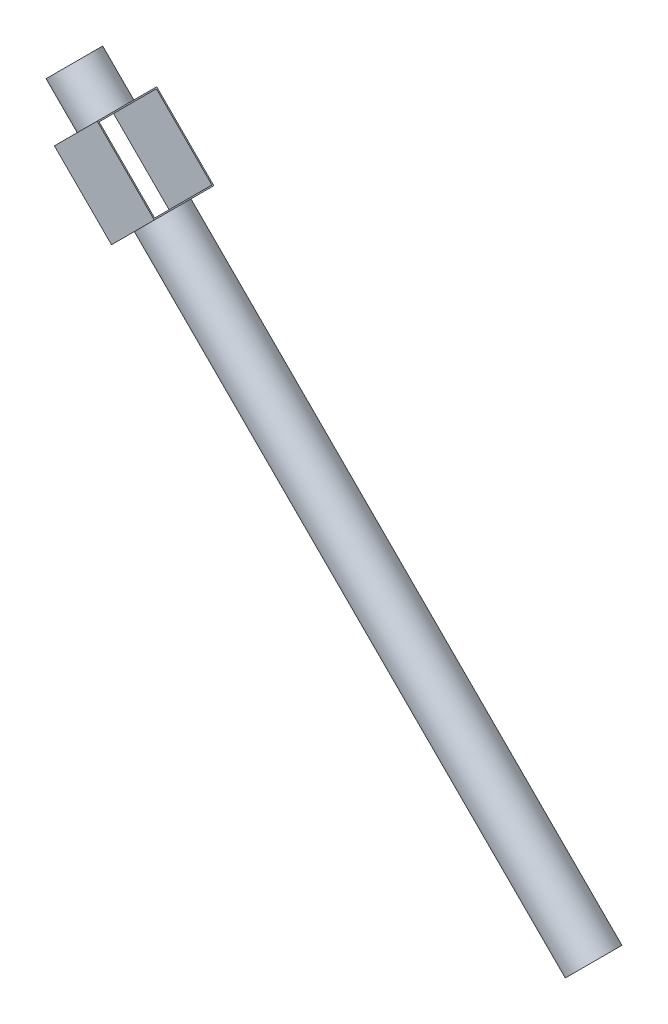
from build123d import *

# Parameters (mm, degrees)
CROQUIS1_R              = 63
CROQUIS1_R_2            = 60
SALIENTE_EXTRUIR1_DEPTH = 2000
CROQUIS3_W              = 162
CROQUIS3_H              = 220
SALIENTE_EXTRUIR2_DEPTH = 82.5
CROQUIS5_W              = 156
CROQUIS5_H              = 214
CORTAR_EXTRUIR1_DEPTH   = 165


with BuildPart() as part:
    # Croquis1 → Saliente-Extruir1 (new body)
    with BuildSketch(Plane(origin=(44.333451415, -44.333451415, 0), x_dir=(0, 0, -1), z_dir=(0.7071067811865438, -0.7071067811865512, 0))):
        with Locations((27.566313026, 62.696968258)):
            Circle(CROQUIS1_R)
        with Locations((27.566313026, 62.696968258)):
            Circle(CROQUIS1_R_2, mode=Mode.SUBTRACT)
    extrude(amount=-SALIENTE_EXTRUIR1_DEPTH)

    # Croquis3 → Saliente-Extruir2 (add, symmetric)
    with BuildSketch(Plane(origin=(44.333451415, 44.333451415, 0), x_dir=(0, 0, -1), z_dir=(0.7071067811865488, 0.7071067811865464, 0))):
        with Locations((27.566313026, 1707.303031742)):
            Rectangle(CROQUIS3_W, CROQUIS3_H)
    extrude(amount=SALIENTE_EXTRUIR2_DEPTH, both=True)

    # Croquis5 → Cortar-Extruir1 (cut)
    with BuildSketch(Plane(origin=(102.669760863, 102.669760863, 0), x_dir=(0, 0, -1), z_dir=(0.7071067811865485, 0.7071067811865467, 0))):
        with Locations((27.566313026, 1707.303031742)):
            Rectangle(CROQUIS5_W, CROQUIS5_H)
    extrude(amount=-CORTAR_EXTRUIR1_DEPTH, mode=Mode.SUBTRACT)


solid = part.part
